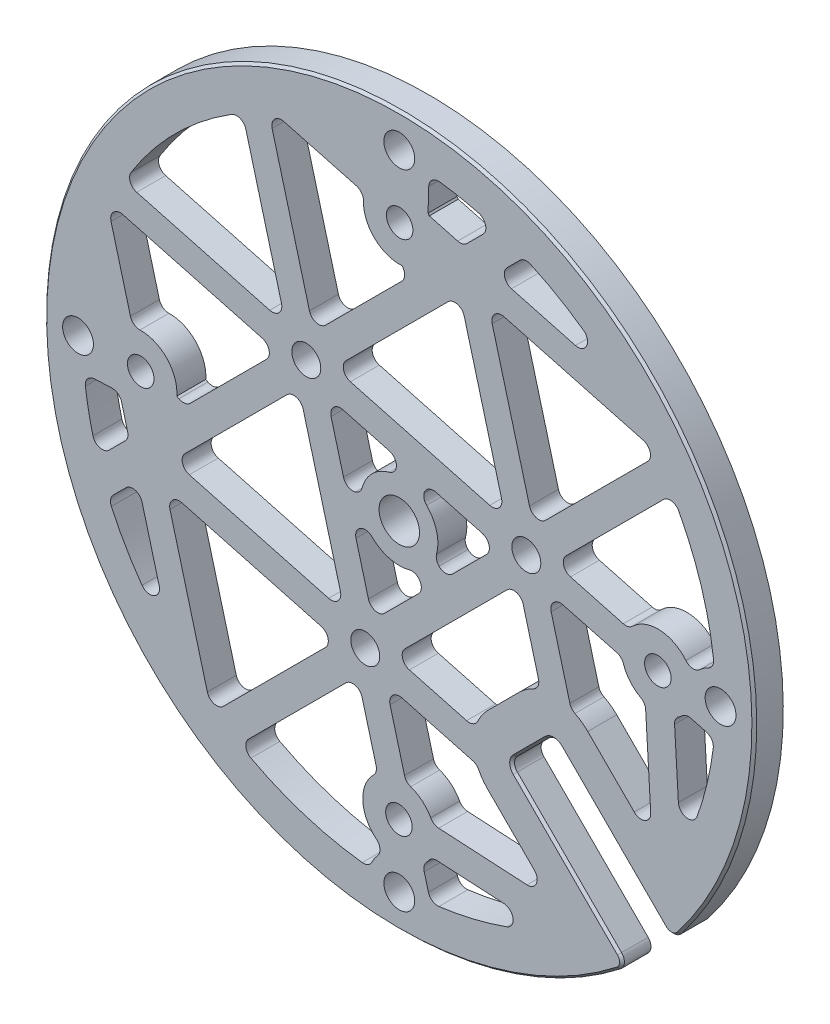
from build123d import *

# Parameters (mm, degrees)
SKETCH1_R           = 36.799999999970176
SKETCH1_R_2         = 1.5999999999999983
SKETCH1_R_3         = 1.5999999999999968
SKETCH1_R_4         = 1.599999999999995
SKETCH1_R_5         = 1.6000000000000003
BOSS_EXTRUDE3_DEPTH = 3
SKETCH2_R           = 2.1000000000000005
CUT_EXTRUDE1_DEPTH  = 10
SKETCH4_R           = 1.3749999999999991
CUT_EXTRUDE3_DEPTH  = 53.12945424611607
CIRPATTERN1_COUNT   = 4
CUT_EXTRUDE6_START  = -10
CUT_EXTRUDE6_DEPTH  = 10
FILLET1_R           = 1
CUT_EXTRUDE8_DEPTH  = 10
FILLET2_R           = 1
DELETEFACE1_START   = -1
DELETEFACE1_DEPTH   = 5
FILLET3_R           = 1
SKETCH8_R           = 1.4999999999999987
SKETCH8_R_2         = 1.4999999999999978
CUT_EXTRUDE9_DEPTH  = 10
CHAMFER1_SIZE       = 0.25


with BuildPart() as part:
    # Sketch1 → Boss-Extrude3 (new body)
    with BuildSketch(Plane.XY):
        Circle(SKETCH1_R)
        with Locations((33.3, -2.2845e-13)):
            Circle(SKETCH1_R_2, mode=Mode.SUBTRACT)
        with Locations((-3.4472e-13, -33.29999999999999)):
            Circle(SKETCH1_R_3, mode=Mode.SUBTRACT)
        with Locations((-33.3, 4.6099e-13)):
            Circle(SKETCH1_R_4, mode=Mode.SUBTRACT)
        with Locations((5.7725e-13, 33.3)):
            Circle(SKETCH1_R_5, mode=Mode.SUBTRACT)
    extrude(amount=BOSS_EXTRUDE3_DEPTH)

    # Sketch2 → Cut-Extrude1 (cut)
    with BuildSketch(Plane.XY.offset(3)):
        Circle(SKETCH2_R)
    extrude(amount=-CUT_EXTRUDE1_DEPTH, mode=Mode.SUBTRACT)

    # Sketch4 → Cut-Extrude3 (cut, through all)
    with BuildSketch(Plane.XY.offset(3)):
        with Locations((0.03669822374002051, 26.800000000000008)):
            Circle(SKETCH4_R)
    cut_extrude3 = extrude(amount=-CUT_EXTRUDE3_DEPTH, mode=Mode.SUBTRACT)

    # CirPattern1: Cut-Extrude3 ×4 about axis
    cirpattern1_axis = Axis((-4.679e-14, 0, 0), (0, 0, 1))
    for i in range(1, CIRPATTERN1_COUNT):
        add(cut_extrude3.rotate(cirpattern1_axis, i * 360 / CIRPATTERN1_COUNT), mode=Mode.SUBTRACT)

    # Sketch5 → Cut-Extrude6 (cut)
    with BuildSketch(Plane.XY.offset(3).offset(CUT_EXTRUDE6_START)):
        with BuildLine():
            Line((15.290381893062348, -11.948483369375927), (11.989102978692467, -15.249762283745746))
            ThreePointArc((11.989102978692467, -15.249762283745746), (11.696209759879011, -15.95686906493229), (11.989102978692456, -16.663975846118838))
            Line((11.989102978692456, -16.663975846118838), (20.532031852541586, -25.206904719968122))
            Line((20.532031852541586, -25.206904719968122), (23.578898008448622, -28.25377087587523))
            ThreePointArc((23.578898008448622, -28.25377087587523), (26.041915246653172, -26.001127865643916), (28.290694840651117, -23.534582754591778))
            Line((28.290694840651117, -23.534582754591778), (25.24458064427226, -20.48846855821292))
            Line((25.24458064427226, -20.48846855821292), (16.70459545543545, -11.948483369375946))
            ThreePointArc((16.70459545543545, -11.948483369375946), (15.997488674248903, -11.655590150562482), (15.290381893062348, -11.948483369375927))
        make_face()
    extrude(amount=CUT_EXTRUDE6_DEPTH, mode=Mode.SUBTRACT)

    # Fillet1
    fillet1_edges = [part.edges().sort_by_distance(p)[0] for p in [
        (28.290694840651113, -23.534582754591774, 1.5),
        (23.57889800844862, -28.253770875875226, 1.5),
    ]]
    fillet(fillet1_edges, radius=FILLET1_R)

    # Sketch6 → Cut-Extrude8 (cut)
    with BuildSketch(Plane(origin=(0, 0, 0), x_dir=(-1, 0, 0), z_dir=(0, 0, -1))):
        with BuildLine():
            ThreePointArc((-9.160675853946312, -12.421335158999586), (-8.364800679025745, -13.45909097745103), (-7.865255292970827, -14.66773022886392))
            Line((-7.865255292970851, -14.66773022886383), (0.6305114449695175, -12.391296392349497))
            Line((0.6305114449695175, -12.391296392349494), (-12.391296392380863, 0.6305114450008169))
            Line((-12.391296392380859, 0.6305114450008169), (-14.660347169321685, -7.837701339495851))
            ThreePointArc((-14.660347169321772, -7.8377013394958315), (-13.47819314958733, -8.336660878228862), (-12.461954768316172, -9.12005624462973))
            Line((-12.461954768316172, -9.120056244629728), (-9.160675853946312, -12.421335158999586))
        make_face()
        with BuildLine():
            Line((1.4069685802769172, -15.289073871216745), (-8.058443193223688, -17.825323311954293))
            ThreePointArc((-8.058443193223717, -17.825323311954254), (-8.525418611776464, -18.714495072734923), (-9.160675853946245, -19.492402970865))
            Line((-9.160675853946243, -19.492402970865), (-15.853409690070725, -26.18513680698949))
            Line((-15.85340969007073, -26.18513680698949), (-3.47853140402988, -25.49399055744305))
            ThreePointArc((-3.4785314040299324, -25.493990557442906), (-2.394221406725407, -23.9446314160484), (-0.6917029340527403, -23.121422591092298))
            Line((-0.691702934052703, -23.121422591092305), (1.4069685802769065, -15.28907387121673))
        make_face()
        with BuildLine():
            Line((-2.6984119583661723, -4.819732301894554), (2.7518317885290386, -10.269976048789736))
            Line((2.7518317885290333, -10.269976048789736), (4.74675945670994, -2.824804633713711))
            Line((4.746759456709937, -2.824804633713719), (3.193520258126749, -2.4086154448009887))
            ThreePointArc((3.193520258126751, -2.408615444801029), (1.035276180394282, -3.863703305160508), (-1.5613619486676082, -3.682682292195852))
            Line((-1.5613619486675585, -3.6826822921959455), (-2.6984119583661736, -4.819732301894552))
        make_face()
        with BuildLine():
            Line((16.554869600863, -28.315654548242886), (4.304746059144151, -16.065531006524107))
            Line((4.304746059144161, -16.065531006524104), (2.2412853018688565, -23.766471392100065))
            ThreePointArc((2.2412853018688637, -23.766471392100073), (3.731594009412354, -27.440503811870656), (1.0916242522725976, -30.398559583267247))
            ThreePointArc((1.0916242522725963, -30.39855958326712), (2.351862825832689, -31.280410623798016), (3.0331020121131376, -32.65945945942718))
            ThreePointArc((3.0331020121131393, -32.659459459427175), (10.03191498440263, -31.228203306356463), (16.554869600863004, -28.315654548242904))
        make_face()
        Polygon((10.415921739065798, 6.741687124922619), (5.649609267396297, -11.046433184097525), (23.437729576416302, -6.2801207124278235), align=None)
        with BuildLine():
            Line((24.214186711723936, -9.177898191295007), (6.426066402703935, -13.944210662964608))
            Line((6.426066402703931, -13.944210662964608), (19.127373131615734, -26.64551739187634))
            ThreePointArc((19.127373131615567, -26.64551739187658), (19.38106023406086, -26.46156654849699), (19.632978370537355, -26.275200480659073))
            Line((19.632978370537966, -26.27520048065945), (24.214186711723933, -9.177898191295007))
        make_face()
        with BuildLine():
            ThreePointArc((-19.53302258018164, -9.120056244629751), (-18.72922024328472, -8.467793279326596), (-17.808330955350527, -7.9950268548894545))
            Line((-17.808330955350474, -7.995026854889488), (-15.289073871248059, 1.4069685803083978))
            Line((-15.289073871248078, 1.4069685803083978), (-23.106961993590723, -0.6878282285901811))
            ThreePointArc((-23.10696199359072, -0.6878282285901522), (-23.92194239546515, -2.440712455182449), (-25.50170250406484, -3.55478344329433))
            Line((-25.501702504064795, -3.5547834432943484), (-26.212521810327505, -15.799555474775639))
            Line((-26.21252181032751, -15.799555474775637), (-19.53302258018164, -9.120056244629753))
        make_face()
        with BuildLine():
            Line((-10.269976048821245, 2.7518317885604766), (-4.819732301925825, -2.698411958334912))
            Line((-4.819732301925821, -2.6984119583349147), (-3.682682292214566, -1.5613619486236678))
            ThreePointArc((-3.682682292214457, -1.5613619486237267), (-3.8637033051574234, 1.035276180405793), (-2.4086154448200547, 3.193520258112401))
            Line((-2.40861544482001, 3.1935202581124003), (-2.824804633745023, 4.746759456741431))
            Line((-2.824804633745032, 4.746759456741428), (-10.269976048821256, 2.751831788560475))
        make_face()
        with BuildLine():
            ThreePointArc((-15.047298847432337, -29.144790227329555), (-9.310099405392958, -31.450946711670316), (-3.24203234376239, -32.63938152416867))
            Line((-3.2420323437630394, -32.63938152416839), (-2.43340438750835, -29.62154090700532))
            ThreePointArc((-2.433404387508275, -29.62154090700532), (-2.926894024602126, -29.097742584704903), (-3.3112398637586007, -28.48932251576663))
            Line((-3.311239863758562, -28.489322515766474), (-15.047298847432323, -29.14479022732948))
        make_face()
        with BuildLine():
            Line((30.126985666512628, -12.969376802524103), (27.111964190591134, -9.954355326602624))
            Line((27.11196419059112, -9.95435532660262), (23.704877167045378, -22.669777204284017))
            ThreePointArc((23.704877167045037, -22.669777204283832), (27.349438861178893, -18.10657874848173), (30.126985666513725, -12.969376802523527))
        make_face()
        with BuildLine():
            Line((3.969977393440718, 0.48916203406449976), (5.523216592017505, 0.07297284515348501))
            Line((5.523216592017505, 0.07297284515349389), (7.518144260198525, 7.518144260229931))
            Line((7.5181442601986035, 7.518144260230001), (0.07297284512217317, 5.523216592048991))
            Line((0.07297284512218166, 5.5232165920489935), (0.4891620340408533, 3.9699773934436293))
            ThreePointArc((0.48916203404077724, 3.9699773934435822), (2.8284271247377677, 2.828427124754614), (3.9699773934406686, 0.48916203406442266))
        make_face()
        with BuildLine():
            Line((-23.811919602112688, 2.2291074907384356), (-16.065531006555688, 4.304746059175592))
            Line((-16.065531006555677, 4.304746059175603), (-28.31565454827428, 16.55486960089414))
            ThreePointArc((-28.31565454827428, 16.554869600894133), (-31.22820330639158, 10.031914984421977), (-32.65945945946076, 3.0331020121196604))
            ThreePointArc((-32.659459459460734, 3.033102012119651), (-31.267164686204882, 2.34042316408517), (-30.38641858239116, 1.0587933334527477))
            ThreePointArc((-30.38641858239108, 1.058793333452747), (-27.45719932474447, 3.655264539825925), (-23.811919602112674, 2.229107490738331))
        make_face()
        Polygon((-6.280120712459166, 23.4377295764475), (-11.04643318412875, 5.649609267427689), (6.741687124891152, 10.415921739097241), align=None)
        with BuildLine():
            Line((-29.672699728266693, -2.447112352311155), (-32.63938152419969, -3.2420323437315197))
            ThreePointArc((-32.639381524199976, -3.2420323437308474), (-31.459042852139373, -9.282705576892361), (-29.170955075576835, -14.996512260473924))
            Line((-29.170955075576465, -14.996512260473875), (-28.49666039395032, -3.3809236209879687))
            ThreePointArc((-28.496660393950382, -3.3809236209879816), (-29.13190133860844, -2.9734883331953337), (-29.672699728266675, -2.447112352311139))
        make_face()
        with BuildLine():
            Line((-26.64551739190773, 19.127373131646873), (-13.944210662995978, 6.426066402735188))
            Line((-13.944210662995973, 6.426066402735195), (-9.177898191326388, 24.214186711755005))
            Line((-9.177898191326385, 24.214186711755005), (-26.275200480690895, 19.63297837056906))
            ThreePointArc((-26.2752004806905, 19.63297837056846), (-26.461566548528396, 19.38106023409198), (-26.645517391907973, 19.127373131646692))
        make_face()
        with BuildLine():
            Line((29.887549735577018, 13.512008392521988), (12.537242082625578, 8.863007468482117))
            Line((12.537242082625578, 8.863007468482124), (22.183179998937483, -0.7829304478297274))
            Line((22.183179998937483, -0.7829304478297263), (23.060608734584527, -0.31857224586828936))
            ThreePointArc((23.06060873458457, -0.31857224586832744), (24.35649825072773, 2.807910572146073), (27.642675231993138, 3.6173951595165614))
            Line((27.642675231993188, 3.6173951595165477), (30.140258261161815, 12.938501920495696))
            ThreePointArc((30.14025826116108, 12.938501920495678), (30.015273789217343, 13.225858737885005), (29.887549735577025, 13.512008392521988))
        make_face()
        with BuildLine():
            Line((28.94523833330654, -3.1124830817863582), (28.00853966275917, -6.608290111651389))
            Line((28.008539662759162, -6.608290111651378), (31.277474696902544, -9.877225145794739))
            ThreePointArc((31.277474696902324, -9.877225145794828), (32.14677740613872, -6.513424782416851), (32.6553958042164, -3.0765443058677446))
            Line((32.6553958042164, -3.0765443058667774), (29.177819684087602, -2.9364350306997817))
            ThreePointArc((29.177819684087595, -2.936435030699758), (29.063241411394536, -3.0267213529853296), (28.945238333306563, -3.1124830817863645))
        make_face()
        with BuildLine():
            Line((16.24464136308463, 28.494764904834565), (11.760784947317832, 11.760784947349272))
            Line((11.760784947317827, 11.760784947349276), (28.494764904803183, 16.244641363116074))
            ThreePointArc((28.49476490480319, 16.24464136311598), (23.19310242286634, 23.193102422897752), (16.24464136308454, 28.494764904834565))
        make_face()
        with BuildLine():
            Line((-22.66977720431551, 23.704877167076454), (-9.954355326633909, 27.11196419062222))
            Line((-9.954355326633914, 27.111964190622217), (-12.969376802555564, 30.126985666543852))
            ThreePointArc((-12.96937680255498, 30.12698566654494), (-18.10657874851321, 27.34943886121005), (-22.66977720431532, 23.704877167076127))
        make_face()
        with BuildLine():
            Line((-0.7829304478608989, 22.18317999896853), (8.863007468450679, 12.537242082657006))
            Line((8.863007468450673, 12.53724208265701), (13.512008392490541, 29.88754973560838))
            ThreePointArc((13.512008392490568, 29.887549735608374), (13.225858737853851, 30.01527378924857), (12.93850192046478, 30.1402582611922))
            Line((12.938501920464802, 30.14025826119296), (3.6173951594855467, 27.642675232024327))
            ThreePointArc((3.617395159485544, 27.642675232024278), (2.807910572114993, 24.35649825075891), (-0.31857224589939726, 23.0606087346158))
            Line((-0.31857224589935673, 23.060608734615762), (-0.7829304478609007, 22.18317999896853))
        make_face()
        with BuildLine():
            Line((-9.87722514582613, 31.277474696933712), (-6.608290111682665, 28.008539662790263))
            Line((-6.60829011168266, 28.008539662790266), (-3.112483081817672, 28.945238333337617))
            ThreePointArc((-3.1124830818176097, 28.945238333337503), (-3.0476821008328976, 29.03527986880542), (-2.9802460897741008, 29.12336522319808))
            Line((-2.980246089774136, 29.12336522319809), (-3.0826020499813507, 32.65482452256765))
            ThreePointArc((-3.082602049981623, 32.65482452256766), (-6.516406476874027, 32.14617312568646), (-9.877225145826198, 31.277474696933588))
        make_face()
    extrude(amount=-CUT_EXTRUDE8_DEPTH, mode=Mode.SUBTRACT)

    # Fillet2
    # the kernel refuses this fillet: 1 mm, written as the material it adds along each edge
    with BuildSketch(Plane(origin=(12.96937680255527, 30.126985666544396, 0), x_dir=(-0.7071067811859402, -0.7071067811871548, 0), z_dir=(0, 0, 1))) as fillet2_piece_1:
        with BuildLine():
            CenterArc((0.6859347900970661, 1.0000000000000004), FILLET2_R, 200.4916651164295, 69.50833488352112)
            ThreePointArc((-0.2507883343146579, 0.6499288812364895), (-0.12711968892665593, 0.32429861279793304), (0, 0))
            Line((0, 0), (0.6859347900962047, 1e-17))
        make_face()
    extrude(amount=3)
    with BuildSketch(Plane(origin=(-30.12698566651318, -12.969376802523815, 0), x_dir=(0.4051395653908752, -0.914254850987892, 0), z_dir=(0, 0, 1))) as fillet2_piece_2:
        with BuildLine():
            CenterArc((0.6860169889693227, 0.9999436119657247), FILLET2_R, 201.1001266792469, 69.50833488351964)
            Line((-0.24693574991175973, 0.6399447411143214), (0, 0))
            ThreePointArc((0, 0), (0.34831822350173736, -0.0018495275242129), (0.6966364470034719, 0))
        make_face()
    extrude(amount=3)
    with BuildSketch(Plane(origin=(9.954355326633912, 27.111964190622217, 0), x_dir=(0.7071067811865496, 0.7071067811865455, 0), z_dir=(0, 0, 1))) as fillet2_piece_3:
        with BuildLine():
            CenterArc((FILLET2_R * 1.73205080757, -FILLET2_R), FILLET2_R, 90.00000000000003, 120.00000000000028)
            Line((FILLET2_R * 0.866025403784, -FILLET2_R * 1.5), (0, 0))
            Line((0, 0), (FILLET2_R * 1.73205080757, 2e-17))
        make_face()
    extrude(amount=3)
    with BuildSketch(Plane(origin=(22.669777204315416, 23.70487716707629, 0), x_dir=(-0.9659258262890589, 0.25881904510255566, 0), z_dir=(0, 0, 1))) as fillet2_piece_4:
        with BuildLine():
            CenterArc((4.567713472573969, -0.9999999999999999), FILLET2_R, 90.00000000000229, 159.38889003671142)
            ThreePointArc((4.215690323749587, -1.9359912941324644), (2.0735758205581676, -1.0426183641352744), (0, 0))
            Line((0, 0), (4.567713472573929, -4e-17))
        make_face()
    extrude(amount=3)
    with BuildSketch(Plane(origin=(3.082602049981487, 32.65482452256765, 0), x_dir=(-0.028971874027574073, -0.9995802271530437, 0), z_dir=(0, 0, 1))) as fillet2_piece_5:
        with BuildLine():
            CenterArc((1.0853582604575887, 1), FILLET2_R, 174.3418827484769, 95.65811725153031)
            ThreePointArc((0.09023035442766808, 1.0985923457501172), (0.04049987786407078, 0.5496752398672234), (0, 0))
            Line((0, 0), (1.0853582604577146, 0))
        make_face()
    extrude(amount=3)
    with BuildSketch(Plane(origin=(6.6082901116826624, 28.008539662790263, 0), x_dir=(-0.9659258262890674, 0.25881904510252424, 0), z_dir=(0, 0, 1))) as fillet2_piece_6:
        with BuildLine():
            CenterArc((FILLET2_R * 0.57735026919, -FILLET2_R), FILLET2_R, 90.00000000000043, 59.99999999999932)
            Line((-FILLET2_R * 0.288675134595, -FILLET2_R * 0.5), (0, 0))
            Line((0, 0), (FILLET2_R * 0.57735026919, -1e-17))
        make_face()
    extrude(amount=3)
    with BuildSketch(Plane(origin=(-31.277474696902438, -9.877225145794785, 0), x_dir=(-0.2759844269127359, 0.9611621070878985, 0), z_dir=(0, 0, 1))) as fillet2_piece_7:
        with BuildLine():
            CenterArc((1.6967713965111377, -0.9996549940693075), FILLET2_R, 88.49490678629388, 120.48440505043072)
            Line((0.8219766929978546, -1.4841487780388307), (0, 0))
            ThreePointArc((0, 0), (0.8615186038013084, 0.01131619452670906), (1.7230372076026175, 3e-17))
        make_face()
    extrude(amount=3)
    with BuildSketch(Plane(origin=(9.877225145826165, 31.277474696933652, 0), x_dir=(-0.7071067811865768, -0.7071067811865182, 0), z_dir=(0, 0, 1))) as fillet2_piece_8:
        with BuildLine():
            CenterArc((1.6965680885793482, -1.0000000000000004), FILLET2_R, 90.00000000000223, 120.48440505043072)
            ThreePointArc((0.8348008166316744, -1.5073038231670115), (0.4075010612799267, -0.7591345374898946), (0, 0))
            Line((0, 0), (1.6965680885793093, 0))
        make_face()
    extrude(amount=3)
    with BuildSketch(Plane(origin=(-8.863007468450675, 12.537242082657007, 0), x_dir=(-0.2588190451025206, 0.9659258262890683, 0), z_dir=(0, 0, 1))) as fillet2_piece_9:
        with BuildLine():
            CenterArc((FILLET2_R * 1.73205080757, -FILLET2_R), FILLET2_R, 90.00000000000006, 119.9999999999998)
            Line((FILLET2_R * 0.866025403784, -FILLET2_R * 1.5), (0, 0))
            Line((0, 0), (FILLET2_R * 1.73205080757, 0))
        make_face()
    extrude(amount=3)
    with BuildSketch(Plane(origin=(-28.494764904803187, 16.24464136311603, 0), x_dir=(0.9659258262890767, -0.2588190451024899, 0), z_dir=(0, 0, 1))) as fillet2_piece_10:
        with BuildLine():
            CenterArc((1.3234873546751686, 1.000000000000001), FILLET2_R, 162.96474446702769, 107.03525553297055)
            ThreePointArc((0.36736268339841704, 1.2929600876841851), (0.17705749860484996, 0.6483620453027262), (0, 0))
            Line((0, 0), (1.323487354675138, 3e-17))
        make_face()
    extrude(amount=3)
    with BuildSketch(Plane(origin=(-16.244641363084583, 28.494764904834565, 0), x_dir=(0.25881904510248854, -0.9659258262890769, 0), z_dir=(0, 0, 1))) as fillet2_piece_11:
        with BuildLine():
            CenterArc((1.3234873546751733, -1.0000000000000002), FILLET2_R, 90.00000000000207, 107.0352555329682)
            ThreePointArc((0.36736268339841316, -1.2929600876841498), (0.17705749860484665, -0.6483620453027137), (0, 0))
            Line((0, 0), (1.3234873546751371, 0))
        make_face()
    extrude(amount=3)
    with BuildSketch(Plane(origin=(-11.76078494731783, 11.760784947349274, 0), x_dir=(-0.9659258262890679, 0.2588190451025222, 0), z_dir=(0, 0, 1))) as fillet2_piece_12:
        with BuildLine():
            CenterArc((FILLET2_R * 1.73205080757, -FILLET2_R), FILLET2_R, 90.00000000000003, 120.00000000000003)
            Line((FILLET2_R * 0.866025403784, -FILLET2_R * 1.5), (0, 0))
            Line((0, 0), (FILLET2_R * 1.73205080757, 3e-17))
        make_face()
    extrude(amount=3)
    with BuildSketch(Plane(origin=(-12.537242082625578, 8.86300746848212, 0), x_dir=(-0.7071067811865506, -0.7071067811865445, 0), z_dir=(0, 0, 1))) as fillet2_piece_13:
        with BuildLine():
            CenterArc((FILLET2_R * 1.73205080757, -FILLET2_R), FILLET2_R, 90.00000000000011, 119.99999999999966)
            Line((FILLET2_R * 0.866025403784, -FILLET2_R * 1.5), (0, 0))
            Line((0, 0), (FILLET2_R * 1.73205080757, -1e-17))
        make_face()
    extrude(amount=3)
    with BuildSketch(Plane(origin=(-32.6553958042164, -3.07654430586726, 0), x_dir=(0.11031861761055096, -0.9938962735660584, 0), z_dir=(0, 0, 1))) as fillet2_piece_14:
        with BuildLine():
            CenterArc((1.0728567141057586, 0.9998620828212532), FILLET2_R, 175.9734790002004, 94.97811523860952)
            Line((0.07532505950278305, 1.0700803002940023), (0, 0))
            ThreePointArc((0, 0), (0.5447322015893362, -0.0045236834628389), (1.0894644031786715, -1e-17))
        make_face()
    extrude(amount=3)
    with BuildSketch(Plane(origin=(-28.008539662759166, -6.6082901116513835, 0), x_dir=(-0.7071067811865521, -0.7071067811865429, 0), z_dir=(0, 0, 1))) as fillet2_piece_15:
        with BuildLine():
            CenterArc((FILLET2_R * 0.57735026919, -FILLET2_R), FILLET2_R, 90.00000000000023, 59.99999999999994)
            Line((-FILLET2_R * 0.288675134595, -FILLET2_R * 0.5), (0, 0))
            Line((0, 0), (FILLET2_R * 0.57735026919, 0))
        make_face()
    extrude(amount=3)
    with BuildSketch(Plane(origin=(-27.111964190591127, -9.954355326602622, 0), x_dir=(0.25881904510252296, -0.9659258262890676, 0), z_dir=(0, 0, 1))) as fillet2_piece_16:
        with BuildLine():
            CenterArc((FILLET2_R * 1.73205080757, -FILLET2_R), FILLET2_R, 89.9999999999998, 120.00000000000023)
            Line((FILLET2_R * 0.866025403784, -FILLET2_R * 1.5), (0, 0))
            Line((0, 0), (FILLET2_R * 1.73205080757, -2e-17))
        make_face()
    extrude(amount=3)
    with BuildSketch(Plane(origin=(-23.704877167045204, -22.669777204283925, 0), x_dir=(-0.6383142151179381, 0.7697759172501895, 0), z_dir=(0, 0, 1))) as fillet2_piece_17:
        with BuildLine():
            CenterArc((4.568260843697049, -0.9974964819411644), FILLET2_R, 85.94488064464137, 159.38889003660256)
            Line((4.150929325871081, -1.9062507964998763), (0, 0))
            ThreePointArc((0, 0), (2.3194884779143035, 0.08211539232977705), (4.638976955828607, 2.7e-16))
        make_face()
    extrude(amount=3)
    with BuildSketch(Plane(origin=(-24.214186711723933, -9.177898191295007, 0), x_dir=(0.9659258262890676, -0.25881904510252296, 0), z_dir=(0, 0, 1))) as fillet2_piece_18:
        with BuildLine():
            CenterArc((FILLET2_R * 1.73205080757, -FILLET2_R), FILLET2_R, 89.99999999999999, 120.00000000000006)
            Line((FILLET2_R * 0.866025403784, -FILLET2_R * 1.5), (0, 0))
            Line((0, 0), (FILLET2_R * 1.73205080757, 2e-17))
        make_face()
    extrude(amount=3)
    with BuildSketch(Plane(origin=(9.177898191326387, 24.214186711755005, 0), x_dir=(0.965925826289069, -0.2588190451025181, 0), z_dir=(0, 0, 1))) as fillet2_piece_19:
        with BuildLine():
            CenterArc((FILLET2_R * 1.73205080757, -FILLET2_R), FILLET2_R, 90.00000000000001, 119.99999999999977)
            Line((FILLET2_R * 0.866025403784, -FILLET2_R * 1.5), (0, 0))
            Line((0, 0), (FILLET2_R * 1.73205080757, -4e-17))
        make_face()
    extrude(amount=3)
    with BuildSketch(Plane(origin=(13.944210662995975, 6.4260664027351915, 0), x_dir=(-0.25881904510252446, 0.9659258262890672, 0), z_dir=(0, 0, 1))) as fillet2_piece_20:
        with BuildLine():
            CenterArc((FILLET2_R * 1.73205080757, -FILLET2_R), FILLET2_R, 90.00000000000003, 119.99999999999932)
            Line((FILLET2_R * 0.866025403784, -FILLET2_R * 1.5), (0, 0))
            Line((0, 0), (FILLET2_R * 1.73205080757, 1e-17))
        make_face()
    extrude(amount=3)
    with BuildSketch(Plane(origin=(28.31565454827428, 16.554869600894136, 0), x_dir=(0.4869271293929198, -0.8734425972330241, 0), z_dir=(0, 0, 1))) as fillet2_piece_21:
        with BuildLine():
            CenterArc((1.323645954545523, -0.999790060464565), FILLET2_R, 88.82593445146814, 107.035255532865)
            Line((0.36171929592693286, -1.2730977688060476), (0, 0))
            ThreePointArc((0, 0), (0.672067915001449, 0.006886016762223), (1.3441358300029036, 1e-17))
        make_face()
    extrude(amount=3)
    with BuildSketch(Plane(origin=(-16.554869600863004, -28.315654548242897, 0), x_dir=(0.7071067811865469, 0.7071067811865482, 0), z_dir=(0, 0, 1))) as fillet2_piece_22:
        with BuildLine():
            CenterArc((1.3234873546751211, -1.0000000000000007), FILLET2_R, 89.99999999999982, 107.035255532968)
            ThreePointArc((0.3673626833983461, -1.2929600876841094), (0.1770574986047851, -0.6483620453027015), (0, 0))
            Line((0, 0), (1.3234873546751245, -5e-17))
        make_face()
    extrude(amount=3)
    with BuildSketch(Plane(origin=(16.06553100655568, 4.3047460591755975, 0), x_dir=(0.7071067811865467, 0.7071067811865482, 0), z_dir=(0, 0, 1))) as fillet2_piece_23:
        with BuildLine():
            CenterArc((FILLET2_R * 1.73205080757, -FILLET2_R), FILLET2_R, 89.9999999999998, 120.0000000000008)
            Line((FILLET2_R * 0.866025403784, -FILLET2_R * 1.5), (0, 0))
            Line((0, 0), (FILLET2_R * 1.73205080757, -1e-17))
        make_face()
    extrude(amount=3)
    with BuildSketch(Plane(origin=(32.65945945946075, 3.033102012119653, 0), x_dir=(-0.9491312438062534, -0.31488074255310444, 0), z_dir=(0, 0, 1))) as fillet2_piece_24:
        with BuildLine():
            CenterArc((0.8061871909128859, -0.9937115375467619), FILLET2_R, 96.42891548045786, 71.93975261591616)
            ThreePointArc((-0.17327795379468827, -0.7920979707835709), (-0.08908669380758233, -0.3955135271614629), (0, 0))
            ThreePointArc((0, 0), (0.34710837386527577, -0.01949423360504042), (0.6942167477305432, -1e-17))
        make_face()
    extrude(amount=3)
    with BuildSketch(Plane(origin=(29.17095507557665, -14.996512260473901, 0), x_dir=(0.3985362896232186, 0.9171525641098965, 0), z_dir=(0, 0, 1))) as fillet2_piece_25:
        with BuildLine():
            CenterArc((4.191920532927633, 0.9978923963011938), FILLET2_R, 116.80904622747101, 156.91151462808148)
            Line((3.7409020706485627, 1.8904070161721653), (0, 0))
            ThreePointArc((0, 0), (2.1284054718270884, -0.06912940132073478), (4.25681094365417, -4e-17))
        make_face()
    extrude(amount=3)
    with BuildSketch(Plane(origin=(32.639381524199834, -3.242032343731183, 0), x_dir=(-0.11209187734446054, -0.9936978469501654, 0), z_dir=(0, 0, 1))) as fillet2_piece_26:
        with BuildLine():
            CenterArc((0.860694536565129, -0.9999112389695566), FILLET2_R, 89.23660025532261, 82.19931696822808)
            Line((-0.12815538998990908, -0.8509957503456531), (0, 0))
            ThreePointArc((0, 0), (0.43700899070186994, 0.00291136179856223), (0.8740179814037393, -1e-17))
        make_face()
    extrude(amount=3)
    with BuildSketch(Plane(origin=(26.21252181032751, -15.799555474775637, 0), x_dir=(-0.7071067811865468, 0.7071067811865481, 0), z_dir=(0, 0, 1))) as fillet2_piece_27:
        with BuildLine():
            CenterArc((FILLET2_R * 2.62715376133, -FILLET2_R), FILLET2_R, 89.9999999999999, 138.3223395127239)
            Line((FILLET2_R * 1.96221457, -FILLET2_R * 1.74689749754), (0, 0))
            Line((0, 0), (FILLET2_R * 2.62715376133, -1e-17))
        make_face()
    extrude(amount=3)
    with BuildSketch(Plane(origin=(15.289073871248068, 1.4069685803083978, 0), x_dir=(0.9659258262890686, -0.25881904510251946, 0), z_dir=(0, 0, 1))) as fillet2_piece_28:
        with BuildLine():
            CenterArc((FILLET2_R * 1.73205080757, -FILLET2_R), FILLET2_R, 89.99999999999999, 120.00000000000028)
            Line((FILLET2_R * 0.866025403784, -FILLET2_R * 1.5), (0, 0))
            Line((0, 0), (FILLET2_R * 1.73205080757, 6e-17))
        make_face()
    extrude(amount=3)
    with BuildSketch(Plane(origin=(17.8083309553505, -7.995026854889471, 0), x_dir=(-0.2588190451025834, 0.9659258262890515, 0), z_dir=(0, 0, 1))) as fillet2_piece_29:
        with BuildLine():
            CenterArc((0.47856853248126585, -0.9999999999999987), FILLET2_R, 89.99999999999652, 48.75880164630642)
            ThreePointArc((-0.27337255331882515, -0.34076968858692236), (-0.13296268670300454, -0.17337198583798694), (0, 0))
            Line((0, 0), (0.47856853248132675, 0))
        make_face()
    extrude(amount=3)
    with BuildSketch(Plane(origin=(12.39129639238086, 0.6305114450008169, 0), x_dir=(0.2588190451025234, -0.9659258262890676, 0), z_dir=(0, 0, 1))) as fillet2_piece_30:
        with BuildLine():
            CenterArc((FILLET2_R * 1.73205080757, -FILLET2_R), FILLET2_R, 90.00000000000006, 119.99999999999952)
            Line((FILLET2_R * 0.866025403784, -FILLET2_R * 1.5), (0, 0))
            Line((0, 0), (FILLET2_R * 1.73205080757, 4e-17))
        make_face()
    extrude(amount=3)
    with BuildSketch(Plane(origin=(7.865255292970838, -14.667730228863874, 0), x_dir=(-0.965925826289055, 0.2588190451025707, 0), z_dir=(0, 0, 1))) as fillet2_piece_31:
        with BuildLine():
            CenterArc((0.9169473447455427, -1), FILLET2_R, 90.00000000000286, 80.45561602827799)
            ThreePointArc((-0.06921010734020742, -0.8341884211047336), (-0.01711783747843747, -0.4185450723469993), (0, 0))
            Line((0, 0), (0.9169473447454928, 3e-17))
        make_face()
    extrude(amount=3)
    with BuildSketch(Plane(origin=(14.660347169321728, -7.837701339495841, 0), x_dir=(-0.25881904510257114, 0.9659258262890549, 0), z_dir=(0, 0, 1))) as fillet2_piece_32:
        with BuildLine():
            CenterArc((0.9085637420475527, 1.0000000000000004), FILLET2_R, 190.0264637622477, 79.9735362377495)
            ThreePointArc((-0.07616370133880736, 0.8258969780797452), (-0.02092729460855873, 0.41453047144094113), (0, 0))
            Line((0, 0), (0.9085637420475041, -1e-17))
        make_face()
    extrude(amount=3)
    with BuildSketch(Plane(origin=(8.058443193223702, -17.82532331195427, 0), x_dir=(0.41325941038566194, -0.9106133426035965, 0), z_dir=(0, 0, 1))) as fillet2_piece_33:
        with BuildLine():
            CenterArc((0.4733548808108342, -0.9990736831868164), FILLET2_R, 92.4663285702169, 48.12392043143318)
            Line((-0.2992706585977442, -0.36421166994803383), (0, 0))
            ThreePointArc((0, 0), (0.21516130945949366, -0.00463158406591831), (0.43032261891898516, 1e-17))
        make_face()
    extrude(amount=3)
    with BuildSketch(Plane(origin=(15.853409690070727, -26.18513680698949, 0), x_dir=(-0.9984439861078086, 0.055763846757105426, 0), z_dir=(0, 0, 1))) as fillet2_piece_34:
        with BuildLine():
            CenterArc((FILLET2_R * 2.6185142682, -FILLET2_R), FILLET2_R, 89.99999999999994, 138.1966912726646)
            Line((FILLET2_R * 1.95193874917, -FILLET2_R * 1.7454375074), (0, 0))
            Line((0, 0), (FILLET2_R * 2.6185142682, 0))
        make_face()
    extrude(amount=3)
    with BuildSketch(Plane(origin=(15.04729884743233, -29.14479022732952, 0), x_dir=(-0.9164873878620938, -0.40006357980915497, 0), z_dir=(0, 0, 1))) as fillet2_piece_35:
        with BuildLine():
            CenterArc((4.1968148339061635, -0.9978874667260091), FILLET2_R, 86.27508905540788, 156.94606645317583)
            Line((3.7462668963332146, -1.8906397033229065), (0, 0))
            ThreePointArc((0, 0), (2.130890503902854, 0.06929109138680388), (4.261781007805709, 1.2e-16))
        make_face()
    extrude(amount=3)
    with BuildSketch(Plane(origin=(3.2420323437627134, -32.639381524168535, 0), x_dir=(-0.2588190451021273, 0.9659258262891737, 0), z_dir=(0, 0, 1))) as fillet2_piece_36:
        with BuildLine():
            CenterArc((0.8605914077485207, -1), FILLET2_R, 90.00000000002329, 82.19931696823353)
            ThreePointArc((-0.130154814766445, -0.8642726167189327), (-0.06795630728387743, -0.43170276149467685), (0, 0))
            Line((0, 0), (0.8605914077481143, 0))
        make_face()
    extrude(amount=3)
    with BuildSketch(Plane(origin=(-3.0331020121131385, -32.65945945942718, 0), x_dir=(-0.9944961838669114, 0.10477280312251934, 0), z_dir=(0, 0, 1))) as fillet2_piece_37:
        with BuildLine():
            CenterArc((0.7984692738691916, -0.9999236097425377), FILLET2_R, 89.2917943587756, 71.93975261542758)
            ThreePointArc((-0.1483572817756193, -0.6781791870623859), (-0.05513475647891043, -0.34325560006642303), (0, 0))
            ThreePointArc((0, 0), (0.40541473967352254, 0.00250560044478213), (0.8108294793470449, 1e-17))
        make_face()
    extrude(amount=3)
    with BuildSketch(Plane(origin=(-4.304746059144156, -16.065531006524104, 0), x_dir=(0.2588190451025187, -0.9659258262890689, 0), z_dir=(0, 0, 1))) as fillet2_piece_38:
        with BuildLine():
            CenterArc((FILLET2_R * 1.73205080757, -FILLET2_R), FILLET2_R, 90.00000000000028, 119.99999999999943)
            Line((FILLET2_R * 0.866025403784, -FILLET2_R * 1.5), (0, 0))
            Line((0, 0), (FILLET2_R * 1.73205080757, 0))
        make_face()
    extrude(amount=3)
    with BuildSketch(Plane(origin=(-0.6305114449695175, -12.391296392349496, 0), x_dir=(0.7071067811865488, 0.7071067811865462, 0), z_dir=(0, 0, 1))) as fillet2_piece_39:
        with BuildLine():
            CenterArc((FILLET2_R * 1.73205080757, -FILLET2_R), FILLET2_R, 89.99999999999993, 120.00000000000011)
            Line((FILLET2_R * 0.866025403784, -FILLET2_R * 1.5), (0, 0))
            Line((0, 0), (FILLET2_R * 1.73205080757, 3e-17))
        make_face()
    extrude(amount=3)
    with BuildSketch(Plane(origin=(-1.4069685802769119, -15.289073871216736, 0), x_dir=(0.9659258262890662, -0.2588190451025286, 0), z_dir=(0, 0, 1))) as fillet2_piece_40:
        with BuildLine():
            CenterArc((FILLET2_R * 1.73205080757, -FILLET2_R), FILLET2_R, 90.00000000000036, 119.99999999999983)
            Line((FILLET2_R * 0.866025403784, -FILLET2_R * 1.5), (0, 0))
            Line((0, 0), (FILLET2_R * 1.73205080757, 3e-17))
        make_face()
    extrude(amount=3)
    with BuildSketch(Plane(origin=(-6.426066402703933, -13.944210662964608, 0), x_dir=(-0.707106781186549, -0.707106781186546, 0), z_dir=(0, 0, 1))) as fillet2_piece_41:
        with BuildLine():
            CenterArc((FILLET2_R * 1.73205080757, -FILLET2_R), FILLET2_R, 89.99999999999997, 120)
            Line((FILLET2_R * 0.866025403784, -FILLET2_R * 1.5), (0, 0))
            Line((0, 0), (FILLET2_R * 1.73205080757, -6e-17))
        make_face()
    extrude(amount=3)
    with BuildSketch(Plane(origin=(-5.6496092673962846, -11.046433184097477, 0), x_dir=(-0.9659258262890607, 0.25881904510254916, 0), z_dir=(0, 0, 1))) as fillet2_piece_42:
        with BuildLine():
            CenterArc((FILLET2_R * 1.73205080757, -FILLET2_R), FILLET2_R, 90.00000000000158, 119.9999999999975)
            Line((FILLET2_R * 0.866025403784, -FILLET2_R * 1.5), (0, 0))
            Line((0, 0), (FILLET2_R * 1.73205080757, 0))
        make_face()
    extrude(amount=3)
    with BuildSketch(Plane(origin=(-23.437729576416306, -6.280120712427822, 0), x_dir=(0.9659258262890678, -0.2588190451025229, 0), z_dir=(0, 0, 1))) as fillet2_piece_43:
        with BuildLine():
            CenterArc((FILLET2_R * 1.73205080757, FILLET2_R), FILLET2_R, 149.99999999999972, 120.00000000000028)
            Line((FILLET2_R * 0.866025403784, FILLET2_R * 1.5), (0, 0))
            Line((0, 0), (FILLET2_R * 1.73205080757, -6e-17))
        make_face()
    extrude(amount=3)
    with BuildSketch(Plane(origin=(-10.415921739065798, 6.741687124922619, 0), x_dir=(0.2588190451025157, -0.9659258262890696, 0), z_dir=(0, 0, 1))) as fillet2_piece_44:
        with BuildLine():
            CenterArc((FILLET2_R * 1.73205080757, -FILLET2_R), FILLET2_R, 89.99999999999999, 120.00000000000006)
            Line((FILLET2_R * 0.866025403784, -FILLET2_R * 1.5), (0, 0))
            Line((0, 0), (FILLET2_R * 1.73205080757, -5e-17))
        make_face()
    extrude(amount=3)
    with BuildSketch(Plane(origin=(-0.4891620340408153, 3.969977393443606, 0), x_dir=(-0.9815866775004107, -0.19101726244950878, 0), z_dir=(0, 0, 1))) as fillet2_piece_45:
        with BuildLine():
            CenterArc((0.6259033753387832, -0.9975788280046893), FILLET2_R, 93.98784358151002, 60.0000000003993)
            Line((-0.2727976417348632, -0.5590169943816603), (0, 0))
            ThreePointArc((0, 0), (0.27817927792836933, -0.00968468798124178), (0.5563585558567395, -1e-17))
        make_face()
    extrude(amount=3)
    with BuildSketch(Plane(origin=(-0.07297284512217742, 5.523216592048993, 0), x_dir=(-0.25881904510252496, -0.9659258262890672, 0), z_dir=(0, 0, 1))) as fillet2_piece_46:
        with BuildLine():
            CenterArc((FILLET2_R, -FILLET2_R), FILLET2_R, 90.00000000000024, 89.99999999999973)
            Line((4.24e-15, -FILLET2_R), (0, 0))
            Line((0, 0), (FILLET2_R, 2e-17))
        make_face()
    extrude(amount=3)
    with BuildSketch(Plane(origin=(-7.518144260198564, 7.518144260229966, 0), x_dir=(0.258819045102538, -0.9659258262890635, 0), z_dir=(0, 0, 1))) as fillet2_piece_47:
        with BuildLine():
            CenterArc((FILLET2_R * 1.73205080757, FILLET2_R), FILLET2_R, 150.00000000000043, 119.99999999999861)
            Line((FILLET2_R * 0.866025403784, FILLET2_R * 1.5), (0, 0))
            Line((0, 0), (FILLET2_R * 1.73205080757, 3e-17))
        make_face()
    extrude(amount=3)
    with BuildSketch(Plane(origin=(-5.523216592017505, 0.07297284515348945, 0), x_dir=(-0.25881904510252096, 0.9659258262890683, 0), z_dir=(0, 0, 1))) as fillet2_piece_48:
        with BuildLine():
            CenterArc((FILLET2_R, -FILLET2_R), FILLET2_R, 90.00000000000006, 89.99999999999989)
            Line((2.6e-16, -FILLET2_R), (0, 0))
            Line((0, 0), (FILLET2_R, -3e-17))
        make_face()
    extrude(amount=3)
    with BuildSketch(Plane(origin=(-3.9699773934406934, 0.48916203406446157, 0), x_dir=(-0.9659258262890862, -0.2588190451024542, 0), z_dir=(0, 0, 1))) as fillet2_piece_49:
        with BuildLine():
            CenterArc((0.622027775375781, -1), FILLET2_R, 90.00000000000395, 60.00000000010701)
            ThreePointArc((-0.24399762840962605, -0.5000000000016767), (-0.11329517526616073, -0.25424733451995274), (0, 0))
            Line((0, 0), (0.622027775375712, 2e-17))
        make_face()
    extrude(amount=3)
    with BuildSketch(Plane(origin=(-4.746759456709938, -2.824804633713715, 0), x_dir=(0.9659258262890691, 0.2588190451025174, 0), z_dir=(0, 0, 1))) as fillet2_piece_50:
        with BuildLine():
            CenterArc((FILLET2_R, -FILLET2_R), FILLET2_R, 90.00000000000023, 89.99999999999977)
            Line((4.43e-15, -FILLET2_R), (0, 0))
            Line((0, 0), (FILLET2_R, -1e-17))
        make_face()
    extrude(amount=3)
    with BuildSketch(Plane(origin=(-3.19352025812675, -2.4086154448010086, 0), x_dir=(0.6562191406000195, -0.7545703675007202, 0), z_dir=(0, 0, 1))) as fillet2_piece_51:
        with BuildLine():
            CenterArc((0.625903375332105, -0.9975788280047371), FILLET2_R, 93.98784358147105, 59.999999999893106)
            Line((-0.27279764173736853, -0.5590169943731572), (0, 0))
            ThreePointArc((0, 0), (0.27817927792537, -0.00968468798105367), (0.5563585558507399, 0))
        make_face()
    extrude(amount=3)
    with BuildSketch(Plane(origin=(-2.751831788529036, -10.269976048789736, 0), x_dir=(-0.25881904510252013, 0.9659258262890685, 0), z_dir=(0, 0, 1))) as fillet2_piece_52:
        with BuildLine():
            CenterArc((FILLET2_R * 1.73205080757, -FILLET2_R), FILLET2_R, 90.00000000000009, 119.99999999999969)
            Line((FILLET2_R * 0.866025403784, -FILLET2_R * 1.5), (0, 0))
            Line((0, 0), (FILLET2_R * 1.73205080757, 3e-17))
        make_face()
    extrude(amount=3)
    with BuildSketch(Plane(origin=(2.698411958366173, -4.819732301894553, 0), x_dir=(-0.7071067811865496, -0.7071067811865456, 0), z_dir=(0, 0, 1))) as fillet2_piece_53:
        with BuildLine():
            CenterArc((FILLET2_R, -FILLET2_R), FILLET2_R, 90, 90.0000000000004)
            Line((6.74e-15, -FILLET2_R), (0, 0))
            Line((0, 0), (FILLET2_R, 5e-17))
        make_face()
    extrude(amount=3)
    with BuildSketch(Plane(origin=(1.5613619486675834, -3.6826822921958993, 0), x_dir=(-0.9455876299571336, -0.3253675369056521, 0), z_dir=(0, 0, 1))) as fillet2_piece_54:
        with BuildLine():
            CenterArc((0.6259033753373777, 0.997578828004701), FILLET2_R, 206.01215641820718, 60.000000000292346)
            Line((-0.2727976417353773, 0.5590169943798444), (0, 0))
            ThreePointArc((0, 0), (0.2781792779277487, 0.00968468798119563), (0.5563585558555002, 0))
        make_face()
    extrude(amount=3)
    with BuildSketch(Plane(origin=(2.8248046337450274, 4.7467594567414295, 0), x_dir=(0.9659258262890681, -0.25881904510252174, 0), z_dir=(0, 0, 1))) as fillet2_piece_55:
        with BuildLine():
            CenterArc((FILLET2_R, -FILLET2_R), FILLET2_R, 90.00000000000006, 90)
            Line((7e-16, -FILLET2_R), (0, 0))
            Line((0, 0), (FILLET2_R, 5e-17))
        make_face()
    extrude(amount=3)
    with BuildSketch(Plane(origin=(2.4086154448200325, 3.193520258112401, 0), x_dir=(0.7545703674970938, -0.6562191406041894, 0), z_dir=(0, 0, 1))) as fillet2_piece_56:
        with BuildLine():
            CenterArc((0.6259033753282637, 0.9975788280047665), FILLET2_R, 206.01215641895257, 59.99999999960073)
            Line((-0.2727976417387856, 0.5590169943682185), (0, 0))
            ThreePointArc((0, 0), (0.2781792779236617, 0.0096846879809341), (0.556358555847323, 0))
        make_face()
    extrude(amount=3)
    with BuildSketch(Plane(origin=(3.6826822922145115, -1.5613619486236974, 0), x_dir=(0.3253675368951812, 0.9455876299607365, 0), z_dir=(0, 0, 1))) as fillet2_piece_57:
        with BuildLine():
            CenterArc((0.6259033753297009, -0.997578828004761), FILLET2_R, 93.98784358145097, 59.999999999707725)
            Line((-0.27279764173820037, -0.5590169943699583), (0, 0))
            ThreePointArc((0, 0), (0.27817927792434166, -0.00968468798095501), (0.5563585558486852, 0))
        make_face()
    extrude(amount=3)
    with BuildSketch(Plane(origin=(4.819732301925823, -2.6984119583349133, 0), x_dir=(-0.7071067811865517, 0.7071067811865432, 0), z_dir=(0, 0, 1))) as fillet2_piece_58:
        with BuildLine():
            CenterArc((FILLET2_R, -FILLET2_R), FILLET2_R, 89.99999999999986, 89.99999999999977)
            Line((-9.11e-15, -FILLET2_R), (0, 0))
            Line((0, 0), (FILLET2_R, 0))
        make_face()
    extrude(amount=3)
    with BuildSketch(Plane(origin=(10.26997604882125, 2.7518317885604757, 0), x_dir=(-0.7071067811865513, -0.7071067811865437, 0), z_dir=(0, 0, 1))) as fillet2_piece_59:
        with BuildLine():
            CenterArc((FILLET2_R * 1.73205080757, -FILLET2_R), FILLET2_R, 90.00000000000018, 119.99999999999994)
            Line((FILLET2_R * 0.866025403784, -FILLET2_R * 1.5), (0, 0))
            Line((0, 0), (FILLET2_R * 1.73205080757, -6e-17))
        make_face()
    extrude(amount=3)
    with BuildSketch(Plane(origin=(11.046433184128734, 5.649609267427685, 0), x_dir=(-0.9659258262890691, 0.2588190451025178, 0), z_dir=(0, 0, 1))) as fillet2_piece_60:
        with BuildLine():
            CenterArc((FILLET2_R * 1.73205080757, -FILLET2_R), FILLET2_R, 89.99999999999976, 120.00000000000068)
            Line((FILLET2_R * 0.866025403784, -FILLET2_R * 1.5), (0, 0))
            Line((0, 0), (FILLET2_R * 1.73205080757, 2e-17))
        make_face()
    extrude(amount=3)
    with BuildSketch(Plane(origin=(-6.741687124891152, 10.415921739097241, 0), x_dir=(0.707106781186549, 0.7071067811865459, 0), z_dir=(0, 0, 1))) as fillet2_piece_61:
        with BuildLine():
            CenterArc((FILLET2_R * 1.73205080757, -FILLET2_R), FILLET2_R, 89.99999999999997, 120)
            Line((FILLET2_R * 0.866025403784, -FILLET2_R * 1.5), (0, 0))
            Line((0, 0), (FILLET2_R * 1.73205080757, 8e-17))
        make_face()
    extrude(amount=3)
    with BuildSketch(Plane(origin=(6.2801207124591665, 23.437729576447495, 0), x_dir=(-0.7071067811865492, -0.7071067811865457, 0), z_dir=(0, 0, 1))) as fillet2_piece_62:
        with BuildLine():
            CenterArc((FILLET2_R * 1.73205080757, FILLET2_R), FILLET2_R, 150.0000000000005, 119.99999999999949)
            Line((FILLET2_R * 0.866025403784, FILLET2_R * 1.5), (0, 0))
            Line((0, 0), (FILLET2_R * 1.73205080757, -4e-17))
        make_face()
    extrude(amount=3)
    with BuildSketch(Plane(origin=(-22.183179998937483, -0.7829304478297269, 0), x_dir=(-0.8838557590592677, 0.4677595506002692, 0), z_dir=(0, 0, 1))) as fillet2_piece_63:
        with BuildLine():
            CenterArc((FILLET2_R * 0.738462598626, -FILLET2_R), FILLET2_R, 90.00000000000016, 72.8889621282362)
            Line((-FILLET2_R * 0.21727375239, -FILLET2_R * 0.705775549373), (0, 0))
            Line((0, 0), (FILLET2_R * 0.738462598626, 0))
        make_face()
    extrude(amount=3)
    with BuildSketch(Plane(origin=(0.7829304478608998, 22.18317999896853, 0), x_dir=(-0.7071067811865495, -0.7071067811865456, 0), z_dir=(0, 0, 1))) as fillet2_piece_64:
        with BuildLine():
            CenterArc((FILLET2_R * 0.738462598626, -FILLET2_R), FILLET2_R, 90, 72.88896212823721)
            Line((-FILLET2_R * 0.21727375239, -FILLET2_R * 0.705775549373), (0, 0))
            Line((0, 0), (FILLET2_R * 0.738462598626, -3e-17))
        make_face()
    extrude(amount=3)
    with BuildSketch(Plane(origin=(-27.642675231993163, 3.6173951595165548, 0), x_dir=(-0.25881904510254694, 0.9659258262890612, 0), z_dir=(0, 0, 1))) as fillet2_piece_65:
        with BuildLine():
            CenterArc((0.8655103085522551, -1.0000000000000009), FILLET2_R, 89.99999999999838, 76.21548491503785)
            ThreePointArc((-0.10568840259845864, -0.7617290125525297), (-0.03326628963620983, -0.3835809030207488), (0, 0))
            Line((0, 0), (0.8655103085522834, -2e-17))
        make_face()
    extrude(amount=3)
    with BuildSketch(Plane(origin=(-3.617395159485546, 27.642675232024303, 0), x_dir=(-0.12361455520199847, -0.9923303087894736, 0), z_dir=(0, 0, 1))) as fillet2_piece_66:
        with BuildLine():
            CenterArc((0.8715629019317254, -0.9947292104821921), FILLET2_R, 95.88527021662182, 76.21548491503665)
            Line((-0.11894837267558835, -0.857297718909859), (0, 0))
            ThreePointArc((0, 0), (0.38451304496988126, -0.01976546069177974), (0.7690260899397654, -1e-17))
        make_face()
    extrude(amount=3)
    with BuildSketch(Plane(origin=(23.106961993590723, -0.6878282285901669, 0), x_dir=(0.24163961644994425, -0.9703660627628751, 0), z_dir=(0, 0, 1))) as fillet2_piece_67:
        with BuildLine():
            CenterArc((0.5905796107008042, -0.9975833478784387), FILLET2_R, 93.9841180629172, 57.03254986335499)
            Line((-0.28418109548778053, -0.5130281839306704), (0, 0))
            ThreePointArc((0, 0), (0.2605498282503523, -0.00906244545585669), (0.521099656500704, 1e-17))
        make_face()
    extrude(amount=3)
    with BuildSketch(Plane(origin=(29.672699728266686, -2.447112352311147, 0), x_dir=(0.9659258262890653, -0.2588190451025316, 0), z_dir=(0, 0, 1))) as fillet2_piece_68:
        with BuildLine():
            CenterArc((0.5864783137847773, -1), FILLET2_R, 90.0000000000005, 57.03254986335527)
            ThreePointArc((-0.2525015294888318, -0.45583750351518076), (-0.11832329355765935, -0.23231000650121653), (0, 0))
            Line((0, 0), (0.5864783137847688, -1e-17))
        make_face()
    extrude(amount=3)
    with BuildSketch(Plane(origin=(25.501702504064816, -3.554783443294339, 0), x_dir=(-0.9110784859693458, 0.4122329346423021, 0), z_dir=(0, 0, 1))) as fillet2_piece_69:
        with BuildLine():
            CenterArc((0.6061512688733971, 0.9974540645682813), FILLET2_R, 207.6675211687507, 58.243136140703086)
            Line((-0.2795057161576531, 0.5331139899831658), (0, 0))
            ThreePointArc((0, 0), (0.2674196774441616, 0.00954725786894567), (0.534839354888318, 2e-17))
        make_face()
    extrude(amount=3)
    with BuildSketch(Plane(origin=(23.81191960211268, 2.2291074907383828, 0), x_dir=(0.6608815206878325, 0.7504902501787335, 0), z_dir=(0, 0, 1))) as fillet2_piece_70:
        with BuildLine():
            CenterArc((0.6217512448301215, 0.9973211550752291), FILLET2_R, 206.36713726641838, 59.43809020379206)
            Line((-0.2742153943059872, 0.5531997960356697), (0, 0))
            ThreePointArc((0, 0), (0.2743020197780145, 0.01004566846788857), (0.5486040395560298, 1e-17))
        make_face()
    extrude(amount=3)
    with BuildSketch(Plane(origin=(30.38641858239112, 1.0587933334527477, 0), x_dir=(-0.47168877923196506, 0.8817651022504002, 0), z_dir=(0, 0, 1))) as fillet2_piece_71:
        with BuildLine():
            CenterArc((1.6449362701344679, -0.9810959528762351), FILLET2_R, 101.15839085306027, 94.2386731600659)
            ThreePointArc((0.6808272593701995, -1.2466026672228672), (0.4127741974930083, -0.5837818873897421), (0, 0))
            ThreePointArc((0, 0), (0.7257071780005095, -0.0708901767141176), (1.4514143560010246, -2e-17))
        make_face()
    extrude(amount=3)
    with BuildSketch(Plane(origin=(28.49666039395035, -3.380923620987975, 0), x_dir=(0.8572584307313347, 0.5148863786701388, 0), z_dir=(0, 0, 1))) as fillet2_piece_72:
        with BuildLine():
            CenterArc((0.6061512688733863, -0.997454064568277), FILLET2_R, 94.08934269054974, 58.24313614070273)
            Line((-0.27950571615768977, -0.5331139899832107), (0, 0))
            ThreePointArc((0, 0), (0.26741967744412715, -0.00954725786896144), (0.5348393548882453, -2e-17))
        make_face()
    extrude(amount=3)
    with BuildSketch(Plane(origin=(3.4785314040299067, -25.493990557442977, 0), x_dir=(0.9984439861078019, -0.05576384675722621, 0), z_dir=(0, 0, 1))) as fillet2_piece_73:
        with BuildLine():
            CenterArc((0.6019418341339619, 1), FILLET2_R, 211.75686385930405, 58.243136140702916)
            ThreePointArc((-0.24834734593984348, 0.473684210526213), (-0.11571807735037412, 0.24127527969407056), (0, 0))
            Line((0, 0), (0.6019418341340831, 0))
        make_face()
    extrude(amount=3)
    with BuildSketch(Plane(origin=(2.433404387508313, -29.62154090700532, 0), x_dir=(0.7059142874753378, 0.7082972672107286, 0), z_dir=(0, 0, 1))) as fillet2_piece_74:
        with BuildLine():
            CenterArc((0.5775670416077363, -0.9976887915275868), FILLET2_R, 93.89619667660861, 56.00725867854706)
            Line((-0.28761462215934547, -0.49623023024737023), (0, 0))
            ThreePointArc((0, 0), (0.25480898894460874, -0.00866703177154939), (0.5096179778892228, 4e-17))
        make_face()
    extrude(amount=3)
    with BuildSketch(Plane(origin=(0.6917029340527219, -23.1214225910923, 0), x_dir=(-0.25881904510255305, 0.9659258262890597, 0), z_dir=(0, 0, 1))) as fillet2_piece_75:
        with BuildLine():
            CenterArc((0.5735561108481514, -1), FILLET2_R, 89.99999999999824, 56.007258678546805)
            ThreePointArc((-0.25555229799481133, -0.4409121299957509), (-0.12027759202936622, -0.22480222228061184), (0, 0))
            Line((0, 0), (0.573556110848182, -1e-17))
        make_face()
    extrude(amount=3)
    with BuildSketch(Plane(origin=(3.3112398637585816, -28.489322515766553, 0), x_dir=(-0.5130051953708981, -0.8583855016963338, 0), z_dir=(0, 0, 1))) as fillet2_piece_76:
        with BuildLine():
            CenterArc((0.6061512688733692, 0.9974540645682731), FILLET2_R, 207.66752116874443, 58.24313614070286)
            Line((-0.2795057161577317, 0.5331139899832548), (0, 0))
            ThreePointArc((0, 0), (0.26741967744408907, 0.00954725786897552), (0.5348393548881768, 2e-17))
        make_face()
    extrude(amount=3)
    with BuildSketch(Plane(origin=(-1.0916242522725965, -30.398559583267183, 0), x_dir=(-0.8870349170710976, 0.46170234556115375, 0), z_dir=(0, 0, 1))) as fillet2_piece_77:
        with BuildLine():
            CenterArc((1.6449362701348438, 0.9810959528762155), FILLET2_R, 164.6029359868676, 94.23867316006601)
            ThreePointArc((0.6808272593706031, 1.2466026672229518), (0.4127741974932764, 0.583781887389736), (0, 0))
            ThreePointArc((0, 0), (0.725707178000653, 0.07089017671419345), (1.4514143560012962, 0))
        make_face()
    extrude(amount=3)
    with BuildSketch(Plane(origin=(-2.2412853018688605, -23.76647139210007, 0), x_dir=(-0.7627745599523271, -0.6466644962339697, 0), z_dir=(0, 0, 1))) as fillet2_piece_78:
        with BuildLine():
            CenterArc((0.6348305707900054, -0.9972071043402068), FILLET2_R, 94.28317792816591, 60.42623337529113)
            Line((-0.2693221637212067, -0.5699977497189646), (0, 0))
            ThreePointArc((0, 0), (0.2800723106426469, -0.01047335872422239), (0.560144621285296, 4e-17))
        make_face()
    extrude(amount=3)

    # DeleteFace1: read off the stored shape, not the designer's step
    # DeleteFace1 outline → DeleteFace1 (cut)
    with BuildSketch(Plane.XY.offset(DELETEFACE1_START)):
        with BuildLine():
            Line((-30.325362392, 13.62931994), (-30.140258261, 12.93850192))
            ThreePointArc((-30.140258261, 12.93850192), (-30.015273789, 13.225858738), (-29.887549736, 13.512008393))
            Line((-29.887549736, 13.512008393), (-30.325362392, 13.62931994))
        make_face()
        with BuildLine():
            Line((-13.62931994, 30.325362392), (-13.512008392, 29.887549736))
            ThreePointArc((-13.512008392, 29.887549736), (-13.225858737, 30.015273789), (-12.93850192, 30.140258261))
            Line((-12.93850192, 30.140258261), (-13.62931994, 30.325362392))
        make_face()
        with BuildLine():
            Line((26.9660185, 19.44787424), (26.275200481, 19.632978371))
            ThreePointArc((26.275200481, 19.632978371), (26.461566549, 19.381060234), (26.645517392, 19.127373132))
            Line((26.645517392, 19.127373132), (26.9660185, 19.44787424))
        make_face()
        with BuildLine():
            Line((-19.44787424, -26.9660185), (-19.127373132, -26.645517392))
            ThreePointArc((-19.127373132, -26.645517392), (-19.381060234, -26.461566548), (-19.632978371, -26.275200481))
            Line((-19.632978371, -26.275200481), (-19.44787424, -26.9660185))
        make_face()
        with BuildLine():
            ThreePointArc((-29.177819684, -2.936435031), (-29.063241411, -3.026721353), (-28.945238333, -3.112483082))
            Line((-28.945238333, -3.112483082), (-28.994390476, -2.929044787))
            Line((-28.994390476, -2.929044787), (-29.177819684, -2.936435031))
        make_face()
    extrude(amount=DELETEFACE1_DEPTH, mode=Mode.SUBTRACT)

    # Fillet3
    fillet3_edges = [part.edges().sort_by_distance(p)[0] for p in [
        (-30.325362392, 13.62931994, 1.5),
        (-19.44787424, -26.9660185, 1.5),
        (26.9660185, 19.44787424, 1.5),
        (-28.994390476, -2.929044787, 1.5),
        (-13.62931994, 30.325362392, 1.5),
    ]]
    fillet(fillet3_edges, radius=FILLET3_R)

    # Sketch8 → Cut-Extrude9 (cut)
    with BuildSketch(Plane(origin=(0, 0, 0), x_dir=(-1, 0, 0), z_dir=(0, 0, -1))):
        with Locations((3.5282889238836943, -13.167753527630449)):
            Circle(SKETCH8_R)
        with BuildLine():
            ThreePointArc((11.13946460375823, 9.639464603789806), (10.552606747271307, 10.829494614226661), (9.25123603610444, 11.088353343223405))
            Line((9.251236036104448, 11.088353343223407), (9.639464603758261, 9.639464603789694))
            Line((9.639464603758263, 9.639464603789694), (11.088353343191805, 9.251236036135934))
            ThreePointArc((11.08835334319181, 9.251236036135944), (11.12663189581894, 9.443675315459688), (11.13946460375823, 9.639464603789806))
        make_face()
        with BuildLine():
            Line((9.639464603758261, 9.639464603789694), (9.251236036104448, 11.088353343223407))
            ThreePointArc((9.25123603610444, 11.088353343223405), (8.578804431978366, 10.700124775569583), (8.1905758643246, 10.027693171443476))
            Line((8.190575864324602, 10.027693171443486), (9.639464603758263, 9.639464603789694))
        make_face()
        with BuildLine():
            Line((11.088353343191805, 9.251236036135934), (9.639464603758263, 9.639464603789694))
            Line((9.639464603758261, 9.639464603789694), (10.027693171412015, 8.190575864356205))
            ThreePointArc((10.027693171412022, 8.190575864356207), (10.700124775538026, 8.57880443200996), (11.08835334319181, 9.251236036135944))
        make_face()
        with BuildLine():
            Line((10.027693171412015, 8.190575864356205), (9.639464603758261, 9.639464603789694))
            Line((9.639464603758263, 9.639464603789694), (8.190575864324602, 10.027693171443486))
            ThreePointArc((8.1905758643246, 10.027693171443476), (8.578804431978455, 8.578804432009942), (10.027693171412022, 8.190575864356207))
        make_face()
        with Locations((-13.167753527641954, 3.5282889238407438)):
            Circle(SKETCH8_R_2)
    extrude(amount=-CUT_EXTRUDE9_DEPTH, mode=Mode.SUBTRACT)

    # Chamfer1
    chamfer1_edges = [part.edges().sort_by_distance(p)[0] for p in [
        (22.10418539928724, -17.348073313227815, 3),
        (13.639742435877407, -13.599122826560837, 3),
        (11.696209759879011, -15.95686906493229, 3),
        (17.39117008266134, -22.066042950087827, 3),
        (15.997488674248903, -11.655590150562482, 3),
        (-26.042552880252572, 26.000489216078734, 3),
        (23.084314087400834, -28.23546081481356, 3),
        (28.27193286352634, -23.03869113977524, 3),
    ]]
    chamfer(chamfer1_edges, length=CHAMFER1_SIZE)


solid = part.part
